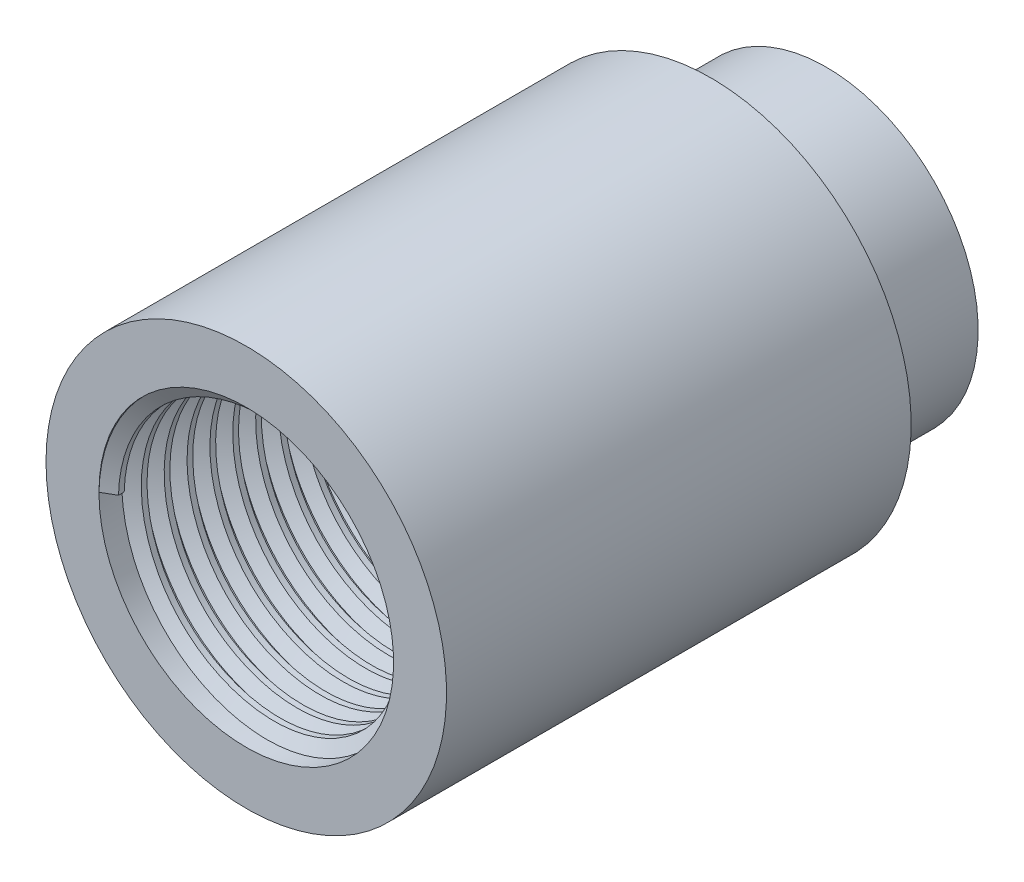
from build123d import *

# Parameters (mm, degrees)
SKETCH1_R           = 2.78
BOSS_EXTRUDE1_DEPTH = 6.45
SKETCH2_R           = 2.11
BOSS_EXTRUDE2_DEPTH = 1.6
SKETCH4_R           = 2.045
CUT_EXTRUDE2_DEPTH  = 10
THREAD2_PITCH       = 0.3175


with BuildPart() as part:
    # Sketch1 → Boss-Extrude1 (new body)
    with BuildSketch(Plane.XY):
        with Locations(Location((0, 0, 0), (0, 0, 180))):
            Circle(SKETCH1_R)
    extrude(amount=BOSS_EXTRUDE1_DEPTH)

    # Sketch2 → Boss-Extrude2 (add)
    with BuildSketch(Plane(origin=(0, 0, 0), x_dir=(-1, 0, 0), z_dir=(0, 0, -1))):
        Circle(SKETCH2_R)
    extrude(amount=BOSS_EXTRUDE2_DEPTH)

    # Sketch4 → Cut-Extrude2 (cut)
    with BuildSketch(Plane(origin=(0, 0, -1.6), x_dir=(-1, 0, 0), z_dir=(0, 0, -1))):
        Circle(SKETCH4_R)
    extrude(amount=-CUT_EXTRUDE2_DEPTH, mode=Mode.SUBTRACT)

    # Thread2: the profile of Thread Profile4 profile screwed along a right-hand helix of 23.622047 turns, 6 arcs to a turn; built about Z, then put on its axis
    thread2_z = Axis((0, 0, 0), (0, 0, 1))
    thread2_corners = [(2.0453, 0, -0.000173205), (2.0453, 0, 0.277985704), (1.873148085, 0, 0.17859375), (1.873148085, 0, 0.09921875)]
    with BuildLine(mode=Mode.PRIVATE) as thread2_profile:
        Line(thread2_corners[0], thread2_corners[1])
        Line(thread2_corners[1], thread2_corners[2])
        Line(thread2_corners[2], thread2_corners[3])
        Line(thread2_corners[3], thread2_corners[0])
    thread2_cap = Face(thread2_profile.wire())
    thread2_turn_angles = [0, 30, 60, 90, 120, 150, 180, 210, 240, 270, 300, 330, 360]
    thread2_turn_weights = [1, 0.8660254037844387, 1, 0.8660254037844387, 1, 0.8660254037844387, 1, 0.8660254037844387, 1, 0.8660254037844387, 1, 0.8660254037844387, 1]
    thread2_turn_rails = [Edge.make_bspline([Vector(p[0], p[1], 0).rotate(thread2_z, thread2_turn_angles[k]) / thread2_turn_weights[k] + Vector(0, 0, p[2] + THREAD2_PITCH * thread2_turn_angles[k] / 360) for k in range(13)], [0, 0, 0, 1, 1, 2, 2, 3, 3, 4, 4, 5, 5, 6, 6, 6], 2, thread2_turn_weights) for p in thread2_corners]
    thread2_turn_sides = [Face.make_surface_from_curves(thread2_turn_rails[p[0]], thread2_turn_rails[p[1]]) for p in [(0, 1), (1, 2), (2, 3), (3, 0)]]
    thread2_last_angles = [8280, 8310, 8340, 8370, 8400, 8430, 8460, 8481.968503937, 8503.937007874]
    thread2_last_weights = [1, 0.8660254037844387, 1, 0.8660254037844387, 1, 0.8660254037844387, 1, 0.9273896394584102, 1]
    thread2_last_rails = [Edge.make_bspline([Vector(p[0], p[1], 0).rotate(thread2_z, thread2_last_angles[k]) / thread2_last_weights[k] + Vector(0, 0, p[2] + THREAD2_PITCH * thread2_last_angles[k] / 360) for k in range(9)], [0, 0, 0, 1, 1, 2, 2, 3, 3, 4, 4, 4], 2, thread2_last_weights) for p in thread2_corners]
    thread2_last_sides = [Face.make_surface_from_curves(thread2_last_rails[p[0]], thread2_last_rails[p[1]]) for p in [(0, 1), (1, 2), (2, 3), (3, 0)]]
    thread2 = Plane(origin=(0, 0, 6.45), x_dir=(-1, 0, 0), z_dir=(0, 0, -1)) * Solid(Shell([*[p.moved(Location((0, 0, THREAD2_PITCH * i))) for i in range(23) for p in thread2_turn_sides], *thread2_last_sides, thread2_cap, thread2_cap.rotate(thread2_z, 8503.937007874).moved(Location((0, 0, THREAD2_PITCH * 8503.937007874 / 360)))]))
    add(thread2)


solid = part.part
